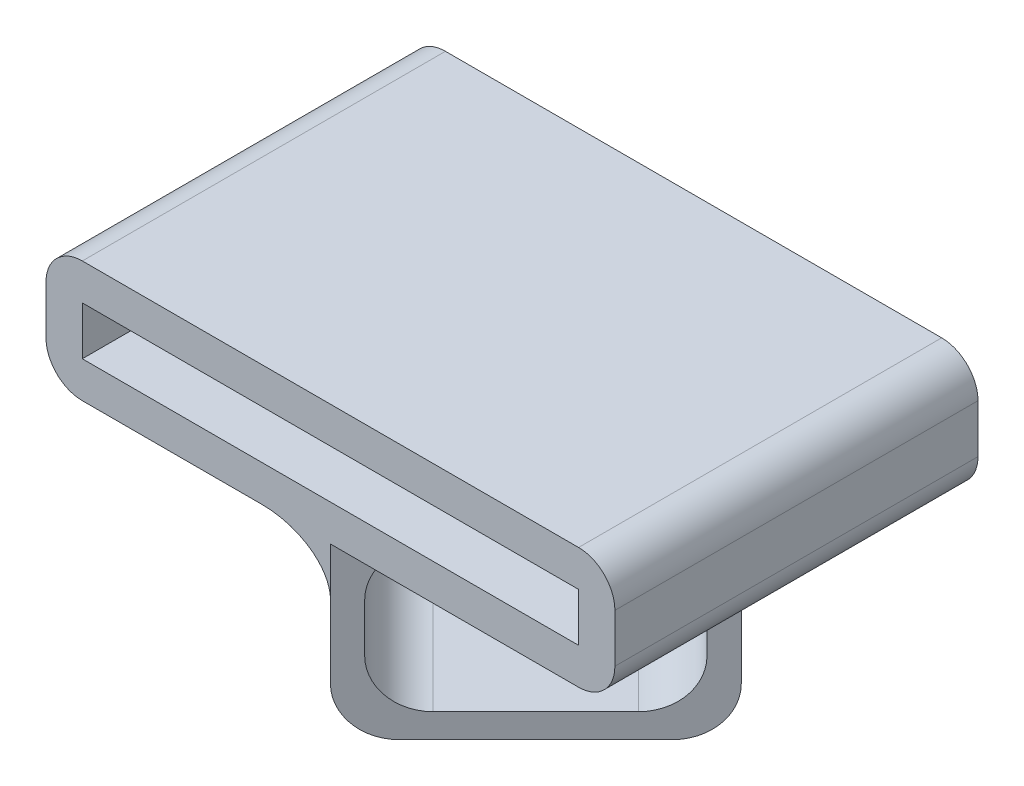
from build123d import *
from OCP.BRepAlgoAPI import BRepAlgoAPI_Cut
from OCP.TopTools import TopTools_ListOfShape

# Parameters (mm, degrees)
CROQUIS1_W              = 23.5
CROQUIS1_H              = 5
CROQUIS1_W_2            = 20.5
CROQUIS1_H_2            = 2
SALIENTE_EXTRUIR1_DEPTH = 15
SALIENTE_EXTRUIR2_DEPTH = 7
CROQUIS3_W              = 10
CROQUIS3_H              = 6
CORTAR_EXTRUIR1_DEPTH   = 9.213203
REDONDEO1_START         = -5.854446225
REDONDEO1_DEPTH         = 9.213203436
REDONDEO1_2_DEPTH       = 9.213203436
REDONDEO1_3_DEPTH       = 0.946564521
REDONDEO1_START_2       = 2.41219269
REDONDEO1_4_DEPTH       = 0.946564521
REDONDEO1_5_DEPTH       = 9.213203436
REDONDEO1_START_3       = -2
REDONDEO1_6_OUTLINE_W   = 11
REDONDEO1_6_OUTLINE_H   = 2.5
REDONDEO1_6_DEPTH       = 2
REDONDEO1_START_4       = 15
REDONDEO1_7_OUTLINE_W   = 11
REDONDEO1_7_OUTLINE_H   = 2.5
REDONDEO1_7_DEPTH       = 2
REDONDEO2_R             = 1.5


with BuildPart() as part:
    # Croquis1 → Saliente-Extruir1 (new body)
    with BuildSketch(Plane.XY):
        with Locations((-10.25, 1)):
            Rectangle(CROQUIS1_W, CROQUIS1_H)
        with Locations((-10.25, 1)):
            Rectangle(CROQUIS1_W_2, CROQUIS1_H_2, mode=Mode.SUBTRACT)
    extrude(amount=SALIENTE_EXTRUIR1_DEPTH)

    # Croquis2 → Saliente-Extruir2 (add)
    with BuildSketch(Plane.XZ.offset(1.5)):
        Polygon((-10.25, 15), (-1.764718626, 6.514718626), (-8.279437252, 0), (-16.764718626, 8.485281374), align=None)
    extrude(amount=SALIENTE_EXTRUIR2_DEPTH)


with BuildPart() as cortar_extruir1_tool:
    # Croquis3 → Cortar-Extruir1 (new body)
    with BuildSketch(Plane(origin=(-4.139718626, 0, -4.139718626), x_dir=(-0.7071067811865468, 0, 0.7071067811865482), z_dir=(-0.7071067811865482, 0, -0.7071067811865468))):
        with Locations((11.854446225, -4.5)):
            Rectangle(CROQUIS3_W, CROQUIS3_H)
    extrude(amount=-CORTAR_EXTRUIR1_DEPTH)


with BuildPart() as part_1:
    add(part.part)

    # Cortar-Extruir1: cut by cortar_extruir1_tool, with a tolerance
    cortar_extruir1_stock = TopTools_ListOfShape()
    cortar_extruir1_stock.Append(part_1.part.wrapped)
    cortar_extruir1_tools = TopTools_ListOfShape()
    cortar_extruir1_tools.Append(cortar_extruir1_tool.part.wrapped)
    cortar_extruir1_cut = BRepAlgoAPI_Cut()
    cortar_extruir1_cut.SetArguments(cortar_extruir1_stock)
    cortar_extruir1_cut.SetTools(cortar_extruir1_tools)
    cortar_extruir1_cut.SetFuzzyValue(0.00001)
    cortar_extruir1_cut.Build()
    add(Compound.cast(cortar_extruir1_cut.Shape()).solids(), mode=Mode.REPLACE)

    # Redondeo1: read off the stored shape, not the designer's step
    # Redondeo1 outline → Redondeo1 (cut)
    with BuildSketch(Plane(origin=(0, 0, 0), x_dir=(0.707106781186546, 0, -0.707106781186549), z_dir=(0.707106781186549, 0, 0.707106781186546)).offset(REDONDEO1_START)):
        with BuildLine():
            Line((-17.854446225, -8.5), (-15.854446225, -8.5))
            ThreePointArc((-15.854446225, -8.5), (-17.268659787, -7.914213562), (-17.854446225, -6.5))
            Line((-17.854446225, -6.5), (-17.854446225, -8.5))
        make_face()
        with BuildLine():
            ThreePointArc((-5.854446225, -6.5), (-6.440232663, -7.914213562), (-7.854446225, -8.5))
            Line((-7.854446225, -8.5), (-5.854446225, -8.5))
            Line((-5.854446225, -8.5), (-5.854446225, -6.5))
        make_face()
    extrude(amount=REDONDEO1_DEPTH, mode=Mode.SUBTRACT)

    # Redondeo1 2 outline → Redondeo1 2 (add)
    with BuildSketch(Plane(origin=(0, 0, 0), x_dir=(0.707106781186546, 0, -0.707106781186549), z_dir=(0.707106781186549, 0, 0.707106781186546)).offset(REDONDEO1_START)):
        with BuildLine():
            Line((-14.854446225, -1.5), (-16.854446225, -1.5))
            Line((-16.854446225, -1.5), (-16.854446225, -3.5))
            ThreePointArc((-16.854446225, -3.5), (-16.268659787, -2.085786438), (-14.854446225, -1.5))
        make_face()
        with BuildLine():
            Line((-6.854446225, -3.5), (-6.854446225, -1.5))
            Line((-6.854446225, -1.5), (-8.854446225, -1.5))
            ThreePointArc((-8.854446225, -1.5), (-7.440232663, -2.085786438), (-6.854446225, -3.5))
        make_face()
        with BuildLine():
            ThreePointArc((-14.854446225, -7.5), (-16.268659787, -6.914213562), (-16.854446225, -5.5))
            Line((-16.854446225, -5.5), (-16.854446225, -7.5))
            Line((-16.854446225, -7.5), (-14.854446225, -7.5))
        make_face()
        with BuildLine():
            Line((-6.854446225, -7.5), (-6.854446225, -5.5))
            ThreePointArc((-6.854446225, -5.5), (-7.440232663, -6.914213562), (-8.854446225, -7.5))
            Line((-8.854446225, -7.5), (-6.854446225, -7.5))
        make_face()
    extrude(amount=REDONDEO1_2_DEPTH)

    # Redondeo1 3 outline → Redondeo1 3 (add)
    with BuildSketch(Plane(origin=(0, 0, 0), x_dir=(0.707106781186546, 0, -0.707106781186549), z_dir=(0.707106781186549, 0, 0.707106781186546)).offset(REDONDEO1_START)):
        with BuildLine():
            ThreePointArc((-19.854446225, -1.5), (-18.440232663, -2.085786438), (-17.854446225, -3.5))
            Line((-17.854446225, -3.5), (-17.854446225, -1.5))
            Line((-17.854446225, -1.5), (-19.854446225, -1.5))
        make_face()
    extrude(amount=REDONDEO1_3_DEPTH)

    # Redondeo1 4 outline → Redondeo1 4 (add)
    with BuildSketch(Plane(origin=(0, 0, 0), x_dir=(0.707106781186546, 0, -0.707106781186549), z_dir=(0.707106781186549, 0, 0.707106781186546)).offset(REDONDEO1_START_2)):
        with BuildLine():
            Line((-5.854446225, -1.5), (-5.854446225, -3.5))
            ThreePointArc((-5.854446225, -3.5), (-5.268659787, -2.085786438), (-3.854446225, -1.5))
            Line((-3.854446225, -1.5), (-5.854446225, -1.5))
        make_face()
    extrude(amount=REDONDEO1_4_DEPTH)

    # Redondeo1 5 outline → Redondeo1 5 (add)
    with BuildSketch(Plane(origin=(0, 0, 0), x_dir=(0.7071067811865471, 0, -0.707106781186548), z_dir=(0.707106781186548, 0, 0.707106781186547)).offset(REDONDEO1_START)):
        with BuildLine():
            Line((-5.854446225, -1.5), (-5.854446225, -3.5))
            ThreePointArc((-5.854446225, -3.5), (-5.268659787, -2.085786438), (-3.854446225, -1.5))
            Line((-3.854446225, -1.5), (-5.854446225, -1.5))
        make_face()
        with BuildLine():
            Line((-17.854446225, -3.5), (-17.854446225, -1.5))
            Line((-17.854446225, -1.5), (-19.854446225, -1.5))
            ThreePointArc((-19.854446225, -1.5), (-18.440232663, -2.085786438), (-17.854446225, -3.5))
        make_face()
    extrude(amount=REDONDEO1_5_DEPTH)

    # Redondeo1 6 outline → Redondeo1 6 (cut)
    with BuildSketch(Plane.XY.offset(REDONDEO1_START_3)):
        with Locations((-9.5, -2.75)):
            Rectangle(REDONDEO1_6_OUTLINE_W, REDONDEO1_6_OUTLINE_H)
    extrude(amount=REDONDEO1_6_DEPTH, mode=Mode.SUBTRACT)

    # Redondeo1 7 outline → Redondeo1 7 (cut)
    with BuildSketch(Plane.XY.offset(REDONDEO1_START_4)):
        with Locations((-9.5, -2.75)):
            Rectangle(REDONDEO1_7_OUTLINE_W, REDONDEO1_7_OUTLINE_H)
    extrude(amount=REDONDEO1_7_DEPTH, mode=Mode.SUBTRACT)

    # Redondeo2
    redondeo2_edges = [part_1.edges().sort_by_distance(p)[0] for p in [
        (-22, -1.5, 7.5),
        (-22, 3.5, 7.5),
        (1.5, 3.5, 7.5),
        (1.5, -1.5, 7.5),
    ]]
    fillet(redondeo2_edges, radius=REDONDEO2_R)


solid = part_1.part
